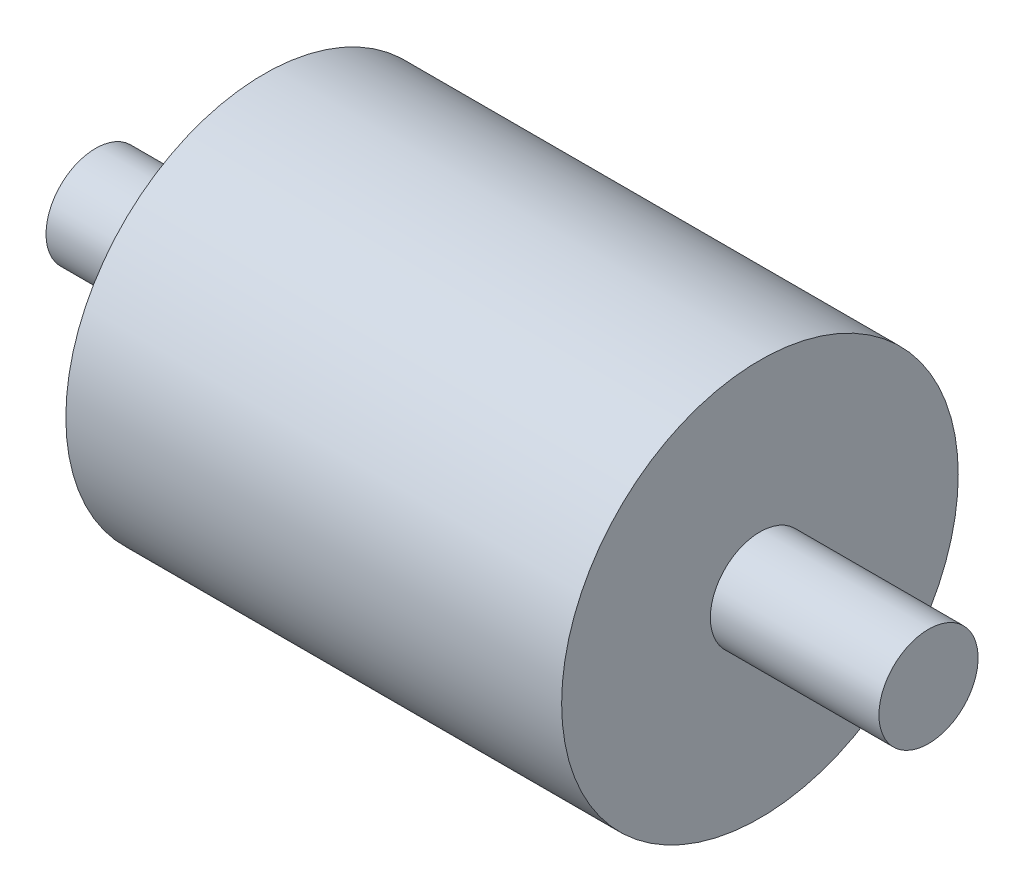
from build123d import *

# Parameters (mm, degrees)
SKETCH_1_R      = 20
EXTRUDE_1_DEPTH = 25
SKETCH_2_R      = 5
EXTRUDE_2_DEPTH = 42


with BuildPart() as part:
    # 草图1 → 凸台-拉伸1 (new, symmetric)
    with BuildSketch(Plane(origin=(0, 0, 0), x_dir=(0, 0, -1), z_dir=(1, 0, 0))):
        Circle(SKETCH_1_R)
    extrude(amount=EXTRUDE_1_DEPTH, both=True)

    # 草图2 → 凸台-拉伸2 (add, symmetric)
    with BuildSketch(Plane(origin=(0, 0, 0), x_dir=(0, 0, -1), z_dir=(1, 0, 0))):
        Circle(SKETCH_2_R)
    extrude(amount=EXTRUDE_2_DEPTH, both=True)


solid = part.part
